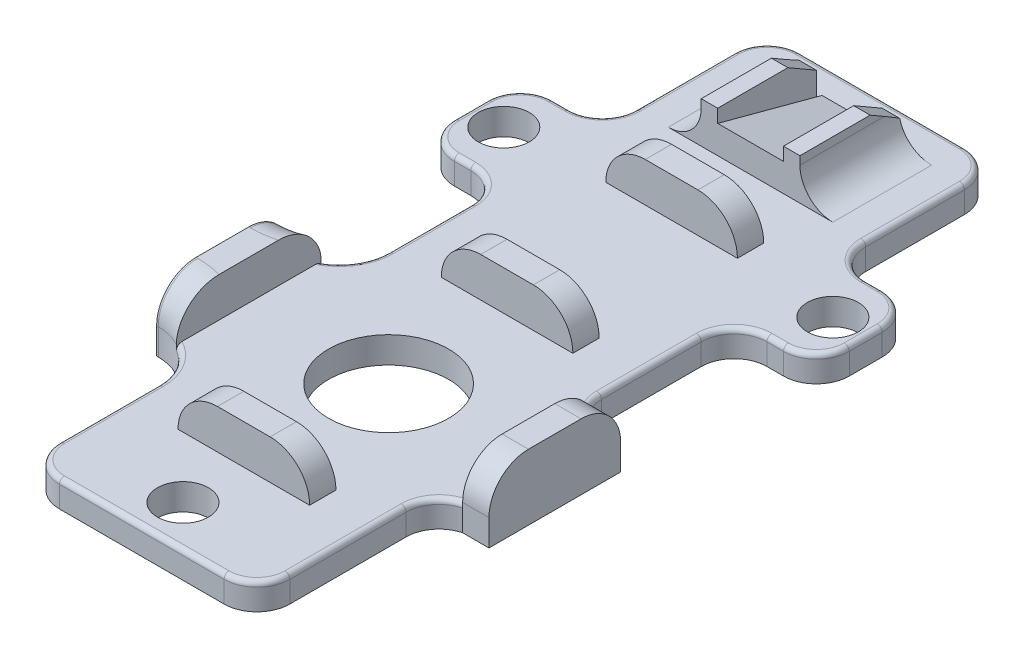
from build123d import *
from OCP.BRepFilletAPI import BRepFilletAPI_MakeChamfer

# Parameters (mm, degrees)
SKETCH1_W            = 14
SKETCH1_H            = 45
BOSS_EXTRUDE1_DEPTH  = 1.6
SKETCH2_R            = 3.65
CUT_EXTRUDE1_DEPTH   = 31.847366176
SKETCH5_W            = 24
SKETCH5_H            = 6
BOSS_EXTRUDE4_DEPTH  = 1.6
SKETCH6_R            = 1.55
CUT_EXTRUDE2_DEPTH   = 33.350579593
SKETCH10_W           = 8
SKETCH10_H           = 1.6
BOSS_EXTRUDE8_DEPTH  = 1.5
SKETCH11_W           = 2.6
SKETCH11_H           = 1.6
CUT_EXTRUDE3_DEPTH   = 1.1
FILLET1_R            = 2
SKETCH12_W           = 8
SKETCH12_H           = 1.6
BOSS_EXTRUDE9_DEPTH  = 1.6
SKETCH13_W           = 8
SKETCH13_H           = 1.6
BOSS_EXTRUDE10_DEPTH = 3.1
SKETCH7_W            = 8
SKETCH7_H            = 1.6
SKETCH7_W_2          = 1.6
SKETCH7_H_2          = 8
BOSS_EXTRUDE5_DEPTH  = 2.4
FILLET6_R            = 3
FILLET2_R            = 0.3
FILLET4_R            = 2.4
SKETCH8_W            = 1
SKETCH8_H            = 6
BOSS_EXTRUDE6_DEPTH  = 2.5
BOSS_EXTRUDE7_DEPTH  = 4
CHAMFER1_SIZE        = 1
CHAMFER1_SIZE2       = 1.732050808
FILLET5_R            = 2
SKETCH14_W           = 0.3
SKETCH14_H           = 2.6
CUT_EXTRUDE4_DEPTH   = 2


# Some blends are built 0.0001 mm under size
with BuildPart() as part:
    # Sketch1 → Boss-Extrude1 (new body)
    with BuildSketch(Plane(origin=(0, 0, 0), x_dir=(1, 0, 0), z_dir=(0, 1, 0))):
        with Locations((0, 7.5)):
            Rectangle(SKETCH1_W, SKETCH1_H)
    extrude(amount=BOSS_EXTRUDE1_DEPTH)

    # Sketch2 → Cut-Extrude1 (cut, through all)
    with BuildSketch(Plane(origin=(0, 0, 0), x_dir=(1, 0, 0), z_dir=(0, 1, 0))):
        with Locations(Location((0, 0, 0), (0, 0, 270))):
            Circle(SKETCH2_R)
    extrude(amount=CUT_EXTRUDE1_DEPTH, mode=Mode.SUBTRACT)

    # Sketch5 → Boss-Extrude4 (add)
    with BuildSketch(Plane(origin=(0, 1.6, 0), x_dir=(1, 0, 0), z_dir=(0, 1, 0))):
        with Locations((0, 17)):
            Rectangle(SKETCH5_W, SKETCH5_H)
    extrude(amount=-BOSS_EXTRUDE4_DEPTH)

    # Sketch6 → Cut-Extrude2 (cut, through all)
    with BuildSketch(Plane(origin=(0, 1.6, 0), x_dir=(1, 0, 0), z_dir=(0, 1, 0))):
        with Locations(Location((-10, 17, 0), (0, 0, 270))):
            Circle(SKETCH6_R)
        with Locations(Location((10, 17, 0), (0, 0, 270))):
            Circle(SKETCH6_R)
        with Locations(Location((0, -12.5, 0), (0, 0, 270))):
            Circle(SKETCH6_R)
    extrude(amount=-CUT_EXTRUDE2_DEPTH, mode=Mode.SUBTRACT)

    # Sketch10 → Boss-Extrude8 (add)
    with BuildSketch(Plane.ZY.offset(-7)):
        with Locations((0, 0.8)):
            Rectangle(SKETCH10_W, SKETCH10_H)
    extrude(amount=-BOSS_EXTRUDE8_DEPTH)

    # Sketch11 → Cut-Extrude3 (cut)
    with BuildSketch(Plane(origin=(8.5, 0, 0), x_dir=(0, 0, -1), z_dir=(1, 0, 0))):
        with Locations((0, 0.8)):
            Rectangle(SKETCH11_W, SKETCH11_H)
    extrude(amount=-CUT_EXTRUDE3_DEPTH, mode=Mode.SUBTRACT)

    # Fillet1
    # the kernel refuses this fillet: 2 mm, written as the material it adds along each edge
    with BuildSketch(Plane(origin=(7, 0, -14), x_dir=(1, 0, 0), z_dir=(0, 1, 0)), Plane(origin=(-7, 0, -20), x_dir=(-1, 0, 0), z_dir=(0, 1, 0))) as fillet1_piece_1:
        with BuildLine():
            CenterArc((FILLET1_R, -FILLET1_R), FILLET1_R, 90, 90)
            Line((0, -FILLET1_R), (0, 0))
            Line((0, 0), (FILLET1_R, 0))
        make_face()
    extrude(amount=1.6)
    with BuildSketch(Plane(origin=(7, 1.6, -20), x_dir=(0, 0, -1), z_dir=(0, -1, 0)), Plane(origin=(-7, 1.6, -14), x_dir=(0, 0, 1), z_dir=(0, -1, 0))) as fillet1_piece_2:
        with BuildLine():
            CenterArc((FILLET1_R, FILLET1_R), FILLET1_R, 180, 90)
            Line((0, FILLET1_R), (0, 0))
            Line((0, 0), (FILLET1_R, 0))
        make_face()
    extrude(amount=1.6)
    with BuildSketch(Plane(origin=(7, 0, -4), x_dir=(0, 0, -1), z_dir=(0, 1, 0)), Plane(origin=(7, 1.6, 4), x_dir=(0, 0, 1), z_dir=(0, -1, 0))) as fillet1_piece_3:
        with BuildLine():
            CenterArc((1.936491673, -2), FILLET1_R, 90, 75.522487814)
            Line((0, -1.5), (0, 0))
            Line((0, 0), (1.936491673, 0))
        make_face()
    extrude(amount=1.6)
    # the kernel refuses this fillet: 2 mm, written as the material it takes off along each edge
    with BuildSketch(Plane(origin=(-7, -5, 15), x_dir=(1, 0, 0), z_dir=(0, 1, 0)), Plane(origin=(7, -5, -30), x_dir=(-1, 0, 0), z_dir=(0, 1, 0)), Plane(origin=(-7, -5, -30), x_dir=(0, 0, 1), z_dir=(0, 1, 0))) as fillet1_2_piece_1:
        with BuildLine():
            CenterArc((FILLET1_R, FILLET1_R), FILLET1_R, 180, 90)
            Line((0, FILLET1_R), (0, 0))
            Line((0, 0), (FILLET1_R, 0))
        make_face()
    extrude(amount=11.6, mode=Mode.SUBTRACT)
    with BuildSketch(Plane(origin=(7, -5, 15), x_dir=(-1, 0, 0), z_dir=(0, 1, 0)), Plane(origin=(12, 6.6, -14), x_dir=(0, 0, -1), z_dir=(0, -1, 0)), Plane(origin=(12, 6.6, -20), x_dir=(-1, 0, 0), z_dir=(0, -1, 0)), Plane(origin=(-12, 6.6, -20), x_dir=(0, 0, 1), z_dir=(0, -1, 0)), Plane(origin=(-12, 6.6, -14), x_dir=(1, 0, 0), z_dir=(0, -1, 0))) as fillet1_2_piece_2:
        with BuildLine():
            CenterArc((FILLET1_R, -FILLET1_R), FILLET1_R, 90, 90)
            Line((0, -FILLET1_R), (0, 0))
            Line((0, 0), (FILLET1_R, 0))
        make_face()
    extrude(amount=11.6, mode=Mode.SUBTRACT)

    # Sketch12 → Boss-Extrude9 (add)
    with BuildSketch(Plane(origin=(8.5, 0, 0), x_dir=(0, 0, -1), z_dir=(1, 0, 0))):
        with Locations((0, 0.8)):
            Rectangle(SKETCH12_W, SKETCH12_H)
    extrude(amount=BOSS_EXTRUDE9_DEPTH)

    # Sketch13 → Boss-Extrude10 (add)
    with BuildSketch(Plane.ZY.offset(7)):
        with Locations((0, 0.8)):
            Rectangle(SKETCH13_W, SKETCH13_H)
    extrude(amount=BOSS_EXTRUDE10_DEPTH)

    # Sketch7 → Boss-Extrude5 (add)
    with BuildSketch(Plane(origin=(0, 1.6, 0), x_dir=(1, 0, 0), z_dir=(0, 1, 0))):
        with Locations((0, 8)):
            Rectangle(SKETCH7_W, SKETCH7_H)
        with Locations((0, 18)):
            Rectangle(SKETCH7_W, SKETCH7_H)
        with Locations((0, -8)):
            Rectangle(SKETCH7_W, SKETCH7_H)
        with Locations((-9.3, 0)):
            Rectangle(SKETCH7_W_2, SKETCH7_H_2)
        with Locations((9.3, 0)):
            Rectangle(SKETCH7_W_2, SKETCH7_H_2)
    extrude(amount=BOSS_EXTRUDE5_DEPTH)

    # Fillet6
    # the kernel refuses this fillet: 3 mm, written as the material it adds along each edge
    with BuildSketch(Plane(origin=(-7, 0, -4), x_dir=(-1, 0, 0), z_dir=(0, 1, 0))) as fillet6_piece_1_section:
        with BuildLine():
            CenterArc((FILLET6_R, -FILLET6_R), FILLET6_R, 90, 90)
            Line((0, -FILLET6_R), (0, 0))
            Line((0, 0), (FILLET6_R, 0))
        make_face()
    fillet6_piece_1 = extrude(amount=1.6, mode=Mode.PRIVATE)
    fillet6_piece_1 = split(fillet6_piece_1, bisect_by=Plane(origin=(-8.5, 0, -4), z_dir=(-1, 0, 0)), keep=Keep.TOP, mode=Mode.PRIVATE)
    add(fillet6_piece_1)
    with BuildSketch(Plane(origin=(-7, 0, -4), x_dir=(-1, 0, 0), z_dir=(0, 1, 0))) as fillet6_piece_2_section:
        with BuildLine():
            CenterArc((FILLET6_R, -FILLET6_R), FILLET6_R, 90, 90)
            Line((0, -FILLET6_R), (0, 0))
            Line((0, 0), (FILLET6_R, 0))
        make_face()
    fillet6_piece_2 = extrude(amount=1.6, mode=Mode.PRIVATE)
    fillet6_piece_2 = split(fillet6_piece_2, bisect_by=Plane(origin=(-8.5, 0, -4), z_dir=(1, 0, 0)), keep=Keep.TOP, mode=Mode.PRIVATE)
    add(fillet6_piece_2)
    with BuildSketch(Plane(origin=(-7, 0, -4), x_dir=(-1, 0, 0), z_dir=(0, 1, 0))) as fillet6_piece_3_section:
        with BuildLine():
            CenterArc((FILLET6_R, -FILLET6_R), FILLET6_R, 90, 90)
            Line((0, -FILLET6_R), (0, 0))
            Line((0, 0), (FILLET6_R, 0))
        make_face()
    fillet6_piece_3 = extrude(amount=9.1, mode=Mode.PRIVATE)
    fillet6_piece_3 = split(fillet6_piece_3, bisect_by=Plane(origin=(-7, 1.6, -4), z_dir=(0, 1, 0)), keep=Keep.TOP, mode=Mode.PRIVATE)
    fillet6_piece_3 = split(fillet6_piece_3, bisect_by=Plane(origin=(-7, 4, -4), z_dir=(0, -1, 0)), keep=Keep.TOP, mode=Mode.PRIVATE)
    fillet6_piece_3 = split(fillet6_piece_3, bisect_by=Plane(origin=(-8.5, 0, -4), z_dir=(-1, 0, 0)), keep=Keep.TOP, mode=Mode.PRIVATE)
    add(fillet6_piece_3)
    with BuildSketch(Plane(origin=(-7, 9.1, 4), x_dir=(0, 0, 1), z_dir=(0, -1, 0))) as fillet6_piece_4_section:
        with BuildLine():
            CenterArc((FILLET6_R, FILLET6_R), FILLET6_R, 180, 90)
            Line((0, FILLET6_R), (0, 0))
            Line((0, 0), (FILLET6_R, 0))
        make_face()
    fillet6_piece_4 = extrude(amount=9.1, mode=Mode.PRIVATE)
    fillet6_piece_4 = split(fillet6_piece_4, bisect_by=Plane(origin=(-7, 1.6, 4), z_dir=(0, 1, 0)), keep=Keep.TOP, mode=Mode.PRIVATE)
    fillet6_piece_4 = split(fillet6_piece_4, bisect_by=Plane(origin=(-8.5, 9.1, 4), z_dir=(-1, 0, 0)), keep=Keep.TOP, mode=Mode.PRIVATE)
    fillet6_piece_4 = split(fillet6_piece_4, bisect_by=Plane(origin=(-7, 4, 4), z_dir=(0, -1, 0)), keep=Keep.TOP, mode=Mode.PRIVATE)
    add(fillet6_piece_4)
    with BuildSketch(Plane(origin=(-7, 1.6, 4), x_dir=(0, 0, 1), z_dir=(0, -1, 0))) as fillet6_piece_5_section:
        with BuildLine():
            CenterArc((FILLET6_R, FILLET6_R), FILLET6_R, 180, 90)
            Line((0, FILLET6_R), (0, 0))
            Line((0, 0), (FILLET6_R, 0))
        make_face()
    fillet6_piece_5 = extrude(amount=1.6, mode=Mode.PRIVATE)
    fillet6_piece_5 = split(fillet6_piece_5, bisect_by=Plane(origin=(-8.5, 1.6, 4), z_dir=(1, 0, 0)), keep=Keep.TOP, mode=Mode.PRIVATE)
    add(fillet6_piece_5)
    with BuildSketch(Plane(origin=(-7, 1.6, 4), x_dir=(0, 0, 1), z_dir=(0, -1, 0))) as fillet6_piece_6_section:
        with BuildLine():
            CenterArc((FILLET6_R, FILLET6_R), FILLET6_R, 180, 90)
            Line((0, FILLET6_R), (0, 0))
            Line((0, 0), (FILLET6_R, 0))
        make_face()
    fillet6_piece_6 = extrude(amount=1.6, mode=Mode.PRIVATE)
    fillet6_piece_6 = split(fillet6_piece_6, bisect_by=Plane(origin=(-8.5, 1.6, 4), z_dir=(-1, 0, 0)), keep=Keep.TOP, mode=Mode.PRIVATE)
    add(fillet6_piece_6)

    # Fillet2
    fillet2_edges = [part.edges().sort_by_distance(p)[0] for p in [
        (0, 1.6, 15),
        (9.5, 1.6, -14),
        (12, 1.6, -17),
        (9.5, 1.6, -20),
        (7, 1.6, -25),
        (0, 1.6, -30),
        (-7, 1.6, -25),
        (-9.5, 1.6, -20),
        (-12, 1.6, -17),
        (-9.5, 1.6, -14),
        (-7, 1.6, -9.5),
        (-6.414213562, 1.6, 14.414213562),
        (-11.414213562, 1.6, -14.585786438),
        (-11.414213562, 1.6, -19.414213562),
        (11.414213562, 1.6, -19.414213562),
        (11.414213562, 1.6, -14.585786438),
        (-6.414213562, 1.6, -29.414213562),
        (6.414213562, 1.6, -29.414213562),
        (6.414213562, 1.6, 14.414213562),
        (7.41886117, 1.6, -4.711746802),
        (7.41886117, 1.6, 4.711746802),
        (7.585786438, 1.6, -13.414213562),
        (7.585786438, 1.6, -20.585786438),
        (-7.585786438, 1.6, -20.585786438),
        (-7.585786438, 1.6, -13.414213562),
        (-7, 1.6, 10),
        (-7.401923789, 1.6, -5.5),
        (-7.401923789, 1.6, 5.5),
        (7, 1.6, -8.968245837),
        (7, 1.6, 9.468245837),
    ]]
    fillet(fillet2_edges, radius=FILLET2_R)

    # Fillet4
    fillet4_edges = [part.edges().sort_by_distance(p)[0] for p in [
        (4, 4, -18),
        (4, 4, -8),
        (-4, 4, -8),
        (-4, 4, -18),
        (4, 4, 8),
        (-4, 4, 8),
        (9.3, 4, -4),
        (9.3, 4, 4),
        (-10.05, 4, 4),
        (-10.05, 4, -4),
        (-9.223542865, 4, 4.102222521),
        (-9.223542865, 4, -4.102222521),
    ]]
    fillet(fillet4_edges, radius=FILLET4_R - 0.0001)  # a hair under: the kernel refuses the full size

    # Sketch8 → Boss-Extrude6 (add)
    with BuildSketch(Plane(origin=(0, 1.6, 0), x_dir=(1, 0, 0), z_dir=(0, 1, 0))):
        with Locations((-2.5, 25)):
            Rectangle(SKETCH8_W, SKETCH8_H)
        with Locations((2.5, 25)):
            Rectangle(SKETCH8_W, SKETCH8_H)
    extrude(amount=BOSS_EXTRUDE6_DEPTH)

    # Sketch9 → Boss-Extrude7 (add)
    with BuildSketch(Plane(origin=(-2, 0, 0), x_dir=(0, 0, -1), z_dir=(1, 0, 0))):
        Polygon((22, 1.6), (28.344486373, 1.6), (22, 3.3), align=None)
    extrude(amount=BOSS_EXTRUDE7_DEPTH)

    # Chamfer1: one chamfer whose edges measure the first distance from different faces: ONE call of the kernel's chamfer builder (chamfer() names one face for all edges)
    chamfer1_edges_1 = [part.edges().sort_by_distance(p)[0] for p in [
        (-2.5, 4.1, -28),
    ]]
    chamfer1_side_1 = [part.faces().sort_by_distance(p)[0] for p in [
        (-2.5, 2.85, -28),
    ]]
    chamfer1_edges_2 = [part.edges().sort_by_distance(p)[0] for p in [
        (2.5, 4.1, -28),
    ]]
    chamfer1_side_2 = [part.faces().sort_by_distance(p)[0] for p in [
        (2.5, 2.85, -28),
    ]]
    chamfer1 = BRepFilletAPI_MakeChamfer(part.part.solid().wrapped)
    for e in chamfer1_edges_1:
        chamfer1.Add(CHAMFER1_SIZE, CHAMFER1_SIZE2, e.wrapped, chamfer1_side_1[0].wrapped)  # the first distance lies on this face
    for e in chamfer1_edges_2:
        chamfer1.Add(CHAMFER1_SIZE, CHAMFER1_SIZE2, e.wrapped, chamfer1_side_2[0].wrapped)  # the first distance lies on this face
    add(Compound.cast(chamfer1.Shape()), mode=Mode.REPLACE)

    # Fillet5
    # the kernel refuses this fillet: 2 mm, written as the material it adds along each edge
    with BuildSketch(Plane(origin=(3, 1.6, -22), x_dir=(0, 1, 0), z_dir=(0, 0, -1))) as fillet5_piece_1_section:
        with BuildLine():
            CenterArc((FILLET5_R, FILLET5_R), FILLET5_R, 180, 90)
            Line((0, FILLET5_R), (0, 0))
            Line((0, 0), (FILLET5_R, 0))
        make_face()
    fillet5_piece_1 = extrude(amount=6, mode=Mode.PRIVATE)
    fillet5_piece_1 = split(fillet5_piece_1, bisect_by=Plane(origin=(3, 5.323076211, -24.149519053), z_dir=(0, -0.8660254037844397, 0.4999999999999982)), keep=Keep.TOP, mode=Mode.PRIVATE)
    add(fillet5_piece_1)
    with BuildSketch(Plane(origin=(-3, 1.6, -28), x_dir=(-1, 0, 0), z_dir=(0, 0, 1))) as fillet5_piece_2_section:
        with BuildLine():
            CenterArc((FILLET5_R, -FILLET5_R), FILLET5_R, 90, 90)
            Line((0, -FILLET5_R), (0, 0))
            Line((0, 0), (FILLET5_R, 0))
        make_face()
    fillet5_piece_2 = extrude(amount=6, mode=Mode.PRIVATE)
    fillet5_piece_2 = split(fillet5_piece_2, bisect_by=Plane(origin=(-3, 2.725, -28.649519053), z_dir=(0, -0.8660254037844397, 0.4999999999999982)), keep=Keep.TOP, mode=Mode.PRIVATE)
    add(fillet5_piece_2)

    # Sketch14 → Cut-Extrude4 (cut)
    with BuildSketch(Plane.XZ):
        with Locations((8.65, 0)):
            Rectangle(SKETCH14_W, SKETCH14_H)
    extrude(amount=-CUT_EXTRUDE4_DEPTH, mode=Mode.SUBTRACT)


solid = part.part
